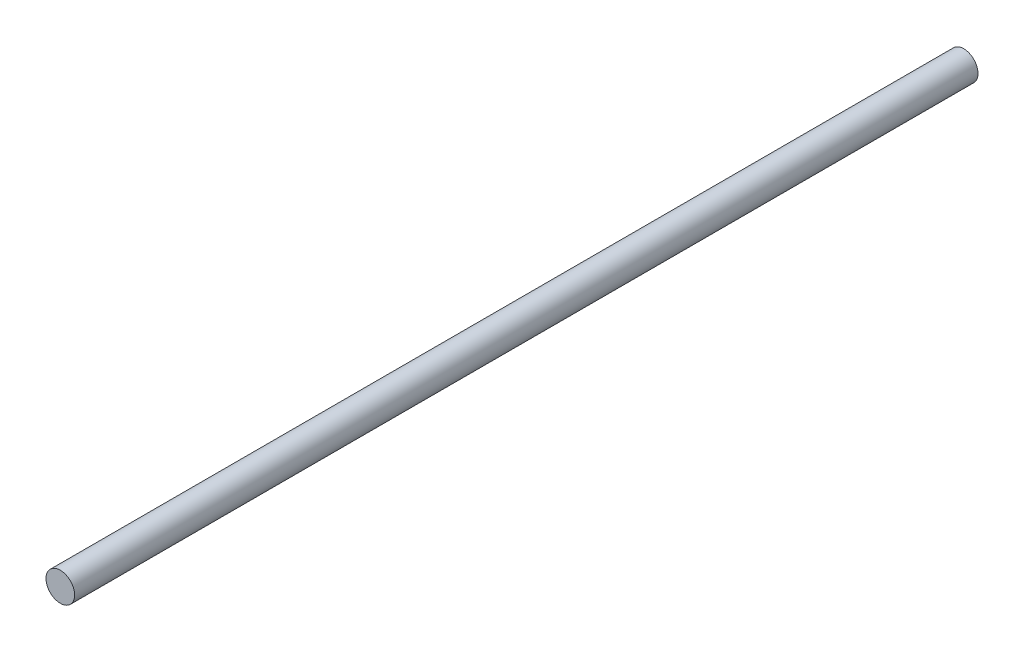
from build123d import *

# Parameters (mm, degrees)
SKETCH2_W = 252.347675392
SKETCH2_H = 4


with BuildPart() as part:
    # Sketch2 → Revolve1 (revolve)
    with BuildSketch(Plane(origin=(0, 0, 0), x_dir=(0, 0, -1), z_dir=(1, 0, 0))):
        with Locations((126.173837696, 2)):
            Rectangle(SKETCH2_W, SKETCH2_H)
    revolve(axis=Axis((0, 0, 0), (0, 0, 1)))


solid = part.part
